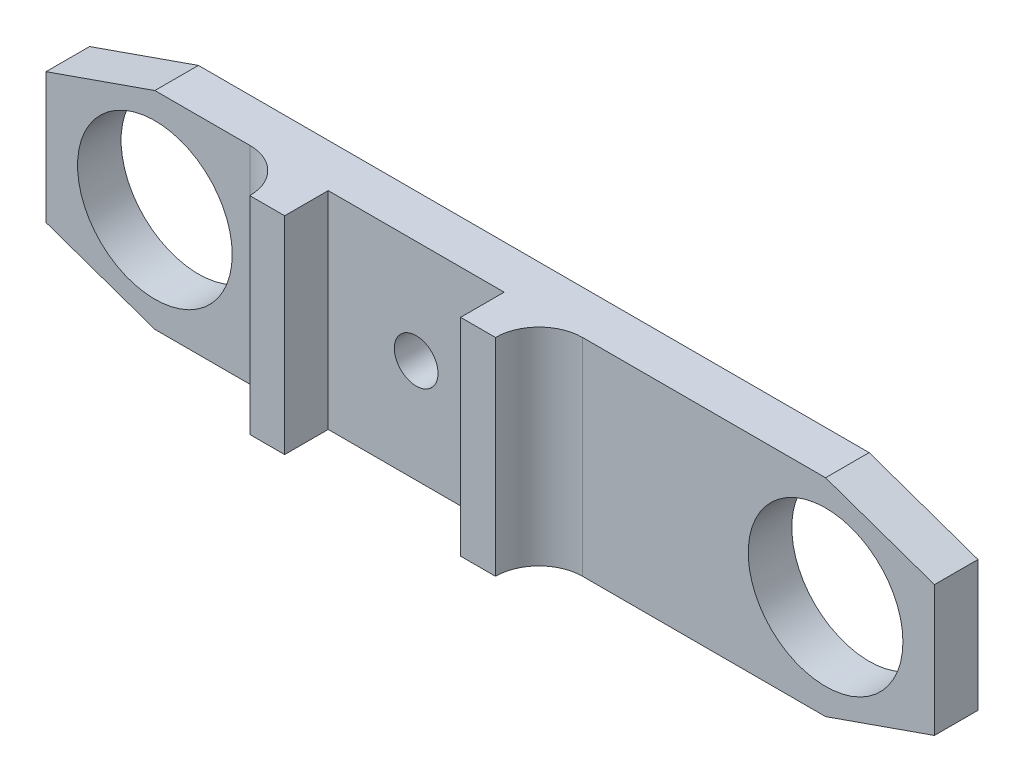
from build123d import *

# Parameters (mm, degrees)
SKETCH1_R           = 3.1877
SKETCH1_R_2         = 11.2776
BOSS_EXTRUDE1_DEPTH = 6.35
SKETCH2_W           = 5.08
SKETCH2_H           = 30.1625
BOSS_EXTRUDE2_DEPTH = 6.35
FILLET1_R           = 6.35


with BuildPart() as part:
    # Sketch1 → Boss-Extrude1 (new body)
    with BuildSketch(Plane.XY):
        Polygon((-38.1, 15.08125), (59.69, 15.08125), (75.565, 9.525), (75.565, -9.525), (59.69, -15.08125), (-38.1, -15.08125), (-53.975, -9.525), (-53.975, 9.525), align=None)
        Circle(SKETCH1_R, mode=Mode.SUBTRACT)
        with Locations((-38.1, 0)):
            Circle(SKETCH1_R_2, mode=Mode.SUBTRACT)
        with Locations((59.69, 0)):
            Circle(SKETCH1_R_2, mode=Mode.SUBTRACT)
    extrude(amount=BOSS_EXTRUDE1_DEPTH)

    # Sketch2 → Boss-Extrude2 (add)
    with BuildSketch(Plane.XY.offset(6.35)):
        with Locations((-15.367, 0)):
            Rectangle(SKETCH2_W, SKETCH2_H)
        with Locations((15.367, 0)):
            Rectangle(SKETCH2_W, SKETCH2_H)
    extrude(amount=BOSS_EXTRUDE2_DEPTH)

    # Fillet1
    fillet1_edges = [part.edges().sort_by_distance(p)[0] for p in [
        (-17.907, 0, 6.35),
        (17.907, 0, 6.35),
    ]]
    fillet(fillet1_edges, radius=FILLET1_R - 0.0001)  # a hair under: the kernel refuses the full size


solid = part.part
